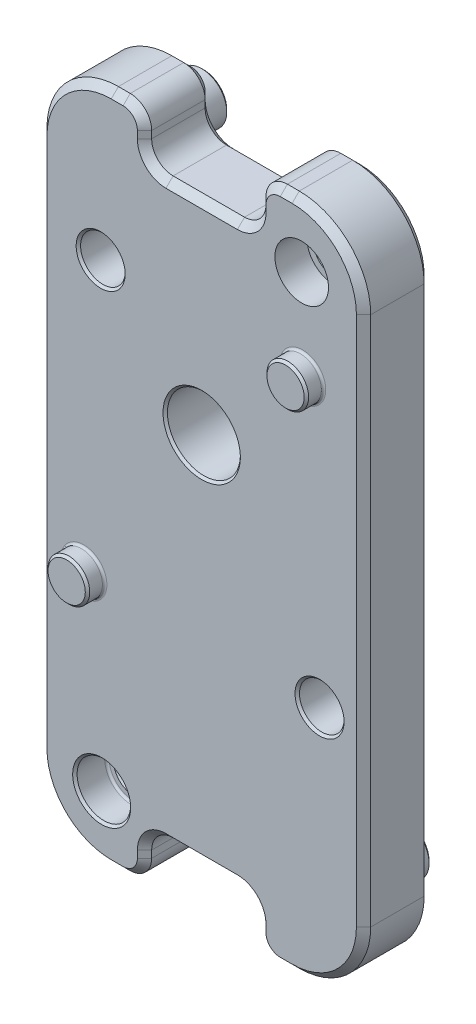
from build123d import *

# Parameters (mm, degrees)
SKETCH2_W                            = 28.7782
SKETCH2_H                            = 59.832519375
SKETCH2_R                            = 3.2385
SKETCH2_R_2                          = 1.5875
BOSS_EXTRUDE1_DEPTH                  = 6.0198
SKETCH3_R                            = 2.38125
CUT_EXTRUDE1_COUNTER_SINK_DEPTH      = 2.8448
SKETCH4_R                            = 2.2225
BOSS_EXTRUDE2_BACKPEGS_DEPTH         = 3.175
SKETCH5_R                            = 1.9812
CUT_EXTRUDE2_ENCODERSCREWHOLES_DEPTH = 42.069031354
SKETCH6_R                            = 1.8542
BOSS_EXTRUDE3_ENCODERPEGS_DEPTH      = 1.524
SKETCH7_R                            = 3.96875
BOSS_EXTRUDE4_DEPTH                  = 3.175
SKETCH10_W                           = 10.16
SKETCH10_H                           = 4.445
CUT_EXTRUDE3_DEPTH                   = 41.731190846
FILLET1_0_25_R                       = 6.35
FILLET5_R                            = 1.905
FILLET4_0_075_R                      = 1.905
FILLET3_1_128_R                      = 0.1984375
CHAMFER1_0_25_SIZE                   = 0.635
CHAMFER2_1_128_SIZE                  = 0.1984375
CHAMFER3_1_64_SIZE                   = 0.396875


with BuildPart() as part:
    # Sketch2 → Boss-Extrude1 (new body)
    with BuildSketch(Plane.XY):
        with Locations((0, -7.434440313)):
            Rectangle(SKETCH2_W, SKETCH2_H)
        Circle(SKETCH2_R, mode=Mode.SUBTRACT)
        with Locations((8.89, 16.982719375)):
            Circle(SKETCH2_R_2, mode=Mode.SUBTRACT)
        with Locations((-8.89, -31.8516)):
            Circle(SKETCH2_R_2, mode=Mode.SUBTRACT)
    extrude(amount=BOSS_EXTRUDE1_DEPTH)

    # Sketch3 → Cut-Extrude1_Counter-sink (cut)
    with BuildSketch(Plane.XY.offset(6.0198)):
        with Locations((-8.89, -31.8516)):
            Circle(SKETCH3_R)
        with Locations((8.89, 16.982719375)):
            Circle(SKETCH3_R)
    extrude(amount=-CUT_EXTRUDE1_COUNTER_SINK_DEPTH, mode=Mode.SUBTRACT)

    # Sketch4 → Boss-Extrude2_BackPegs (add)
    with BuildSketch(Plane(origin=(0, 0, 0), x_dir=(-1, 0, 0), z_dir=(0, 0, -1))):
        with Locations((-8.9916, -31.8516)):
            Circle(SKETCH4_R)
        with Locations((8.9916, 16.982719375)):
            Circle(SKETCH4_R)
    extrude(amount=BOSS_EXTRUDE2_BACKPEGS_DEPTH)

    # Sketch5 → Cut-Extrude2_EncoderScrewHoles (cut, through all)
    with BuildSketch(Plane.XY.offset(6.0198)):
        with Locations((10.4775, -15.748)):
            Circle(SKETCH5_R)
        with Locations((-8.9789, 8.981612037)):
            Circle(SKETCH5_R)
    extrude(amount=-CUT_EXTRUDE2_ENCODERSCREWHOLES_DEPTH, mode=Mode.SUBTRACT)

    # Sketch6 → Boss-Extrude3_EncoderPegs (add)
    with BuildSketch(Plane.XY.offset(6.0198)):
        with Locations((-10.4775, -15.748)):
            Circle(SKETCH6_R)
        with Locations((8.9789, 8.981612037)):
            Circle(SKETCH6_R)
    extrude(amount=BOSS_EXTRUDE3_ENCODERPEGS_DEPTH)

    # Sketch7 → Boss-Extrude4 (add)
    with BuildSketch(Plane(origin=(0, 0, 0), x_dir=(-1, 0, 0), z_dir=(0, 0, -1))):
        with Locations((0, -11.9507)):
            Circle(SKETCH7_R)
    extrude(amount=BOSS_EXTRUDE4_DEPTH)

    # Sketch10 → Cut-Extrude3 (cut, through all)
    with BuildSketch(Plane(origin=(0, 0, 0), x_dir=(-1, 0, 0), z_dir=(0, 0, -1))):
        with Locations((0, 20.259319375)):
            Rectangle(SKETCH10_W, SKETCH10_H)
    cut_extrude3 = extrude(amount=-CUT_EXTRUDE3_DEPTH, mode=Mode.SUBTRACT)

    # Mirror1: Cut-Extrude3 across plane
    add(cut_extrude3.mirror(Plane(origin=(0, -7.434440312, 0), x_dir=(0, 0, 1), z_dir=(0, -1, 0))), mode=Mode.SUBTRACT)

    # Fillet1_0.25
    fillet1_0_25_edges = [part.edges().sort_by_distance(p)[0] for p in [
        (-14.3891, -37.3507, 3.0099),
        (14.3891, -37.3507, 3.0099),
        (14.3891, 22.481819375, 3.0099),
        (-14.3891, 22.481819375, 3.0099),
    ]]
    fillet(fillet1_0_25_edges, radius=FILLET1_0_25_R)

    # Fillet5
    fillet5_edges = [part.edges().sort_by_distance(p)[0] for p in [
        (-5.08, 22.481819375, 3.0099),
        (5.08, 22.481819375, 3.0099),
        (5.08, -37.3507, 3.0099),
        (-5.08, -37.3507, 3.0099),
    ]]
    fillet(fillet5_edges, radius=FILLET5_R)

    # Fillet4_0.075
    fillet4_0_075_edges = [part.edges().sort_by_distance(p)[0] for p in [
        (-5.08, 18.036819375, 3.0099),
        (5.08, 18.036819375, 3.0099),
        (-5.08, -32.9057, 3.0099),
        (5.08, -32.9057, 3.0099),
    ]]
    fillet(fillet4_0_075_edges, radius=FILLET4_0_075_R)

    # Fillet3_1/128
    fillet3_1_128_edges = [part.edges().sort_by_distance(p)[0] for p in [
        (-11.27125, -31.8516, 3.175),
        (11.2141, -31.8516, 0),
        (-6.7691, 16.982719375, 0),
        (7.1247, 8.981612037, 6.0198),
        (-12.3317, -15.748, 6.0198),
        (3.96875, -11.9507, 0),
    ]]
    fillet(fillet3_1_128_edges, radius=FILLET3_1_128_R)

    # Chamfer1_0.25
    chamfer1_0_25_edges = [part.edges().sort_by_distance(p)[0] for p in [
        (-12.529228061, -35.490828061, 6.0198),
        (-14.3891, -7.434440312, 6.0198),
        (-12.529228061, 20.621947436, 6.0198),
        (-12.529228061, -35.490828061, 0),
        (-14.3891, -7.434440312, 0),
        (-12.529228061, 20.621947436, 0),
        (-7.51205, 22.481819375, 0),
        (-7.51205, 22.481819375, 6.0198),
        (5.08, 20.259319375, 0),
        (4.522038418, 18.594780957, 0),
        (0, 18.036819375, 0),
        (-4.522038418, 18.594780957, 0),
        (-5.08, 20.259319375, 0),
        (5.08, 20.259319375, 6.0198),
        (4.522038418, 18.594780957, 6.0198),
        (0, 18.036819375, 6.0198),
        (-4.522038418, 18.594780957, 6.0198),
        (-5.08, 20.259319375, 6.0198),
        (5.637961582, 21.923857793, 0),
        (-5.637961582, 21.923857793, 0),
        (5.637961582, 21.923857793, 6.0198),
        (-5.637961582, 21.923857793, 6.0198),
    ]]
    chamfer(chamfer1_0_25_edges, length=CHAMFER1_0_25_SIZE)

    # Chamfer2_1/128
    chamfer2_1_128_edges = [part.edges().sort_by_distance(p)[0] for p in [
        (-10.4775, -31.8516, 3.175),
        (-3.2385, 0, 6.0198),
        (7.3025, 16.982719375, 0),
        (-10.9601, 8.981612037, 6.0198),
        (-10.9601, 8.981612037, 0),
        (8.4963, -15.748, 6.0198),
        (8.4963, -15.748, 0),
        (11.2141, -31.8516, -3.175),
        (-6.7691, 16.982719375, -3.175),
        (-12.3317, -15.748, 7.5438),
        (7.1247, 8.981612037, 7.5438),
        (-10.4775, -31.8516, 0),
        (-11.27125, -31.8516, 6.0198),
        (7.3025, 16.982719375, 3.175),
    ]]
    chamfer(chamfer2_1_128_edges, length=CHAMFER2_1_128_SIZE)

    # Chamfer3_1/64
    chamfer3_1_64_edges = [part.edges().sort_by_distance(p)[0] for p in [
        (3.96875, -11.9507, -3.175),
    ]]
    chamfer(chamfer3_1_64_edges, length=CHAMFER3_1_64_SIZE)


solid = part.part
